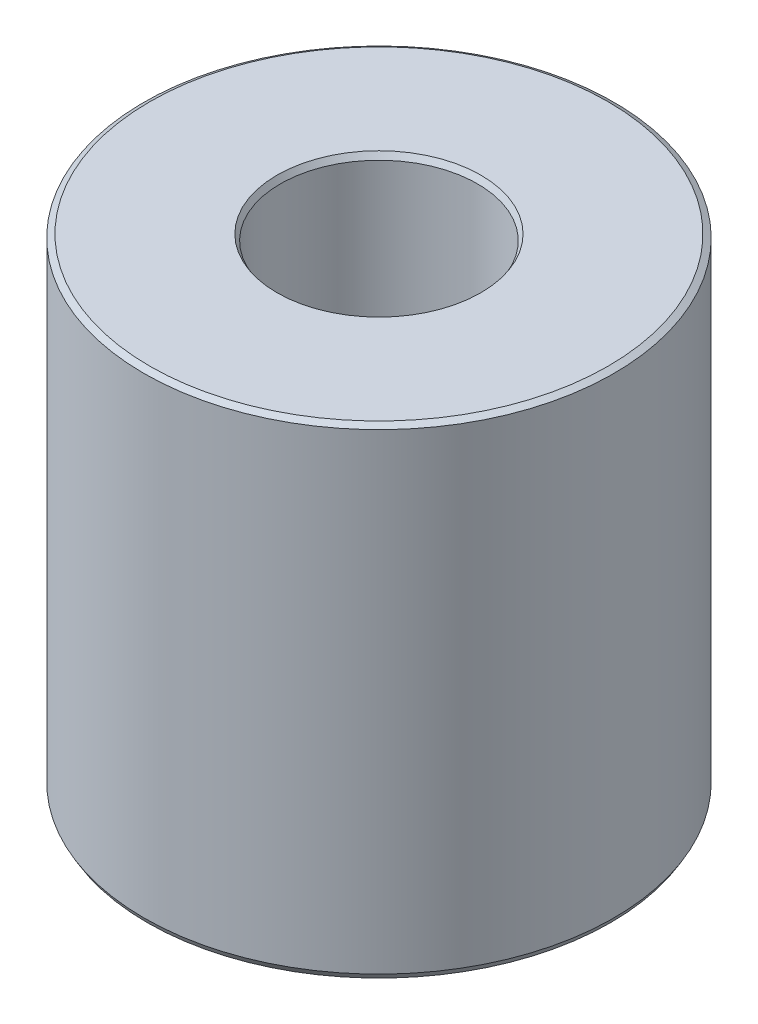
from build123d import *
from OCP.BRepFilletAPI import BRepFilletAPI_MakeChamfer

# Parameters (mm, degrees)
SKETCH1_R           = 55
BOSS_EXTRUDE1_DEPTH = 112.536433339
SKETCH2_R           = 23.070436655
CUT_EXTRUDE1_DEPTH  = 137.80076326
CHAMFER1_SIZE       = 0.788471548
CHAMFER1_SIZE2      = 1.365672781


with BuildPart() as part:
    # Sketch1 → Boss-Extrude1 (new body)
    with BuildSketch(Plane(origin=(0, 0, 0), x_dir=(1, 0, 0), z_dir=(0, 1, 0))):
        Circle(SKETCH1_R)
    extrude(amount=BOSS_EXTRUDE1_DEPTH)

    # Sketch2 → Cut-Extrude1 (cut, through all)
    with BuildSketch(Plane(origin=(0, 0, 0), x_dir=(1, 0, 0), z_dir=(0, 1, 0))):
        Circle(SKETCH2_R)
    extrude(amount=CUT_EXTRUDE1_DEPTH, mode=Mode.SUBTRACT)

    # Chamfer1: one chamfer whose edges measure the first distance from different faces: ONE call of the kernel's chamfer builder (chamfer() names one face for all edges)
    chamfer1_edges_1 = [part.edges().sort_by_distance(p)[0] for p in [
        (-23.070436655, 112.536433339, 0),
    ]]
    chamfer1_side_1 = [part.faces().sort_by_distance(p)[0] for p in [
        (-53.444365081, 112.536433339, 0),
    ]]
    chamfer1_edges_2 = [part.edges().sort_by_distance(p)[0] for p in [
        (-23.070436655, 0, 0),
    ]]
    chamfer1_side_2 = [part.faces().sort_by_distance(p)[0] for p in [
        (-23.070436655, 56.268216669, 0),
    ]]
    chamfer1_edges_3 = [part.edges().sort_by_distance(p)[0] for p in [
        (-55, 0, 0),
    ]]
    chamfer1_side_3 = [part.faces().sort_by_distance(p)[0] for p in [
        (-53.444365081, 0, 0),
    ]]
    chamfer1_edges_4 = [part.edges().sort_by_distance(p)[0] for p in [
        (-55, 112.536433339, 0),
    ]]
    chamfer1_side_4 = [part.faces().sort_by_distance(p)[0] for p in [
        (-55, 56.268216669, 0),
    ]]
    chamfer1 = BRepFilletAPI_MakeChamfer(part.part.solid().wrapped)
    for e in chamfer1_edges_1:
        chamfer1.Add(CHAMFER1_SIZE, CHAMFER1_SIZE2, e.wrapped, chamfer1_side_1[0].wrapped)  # the first distance lies on this face
    for e in chamfer1_edges_2:
        chamfer1.Add(CHAMFER1_SIZE, CHAMFER1_SIZE2, e.wrapped, chamfer1_side_2[0].wrapped)  # the first distance lies on this face
    for e in chamfer1_edges_3:
        chamfer1.Add(CHAMFER1_SIZE, CHAMFER1_SIZE2, e.wrapped, chamfer1_side_3[0].wrapped)  # the first distance lies on this face
    for e in chamfer1_edges_4:
        chamfer1.Add(CHAMFER1_SIZE, CHAMFER1_SIZE2, e.wrapped, chamfer1_side_4[0].wrapped)  # the first distance lies on this face
    add(Compound.cast(chamfer1.Shape()), mode=Mode.REPLACE)


solid = part.part
